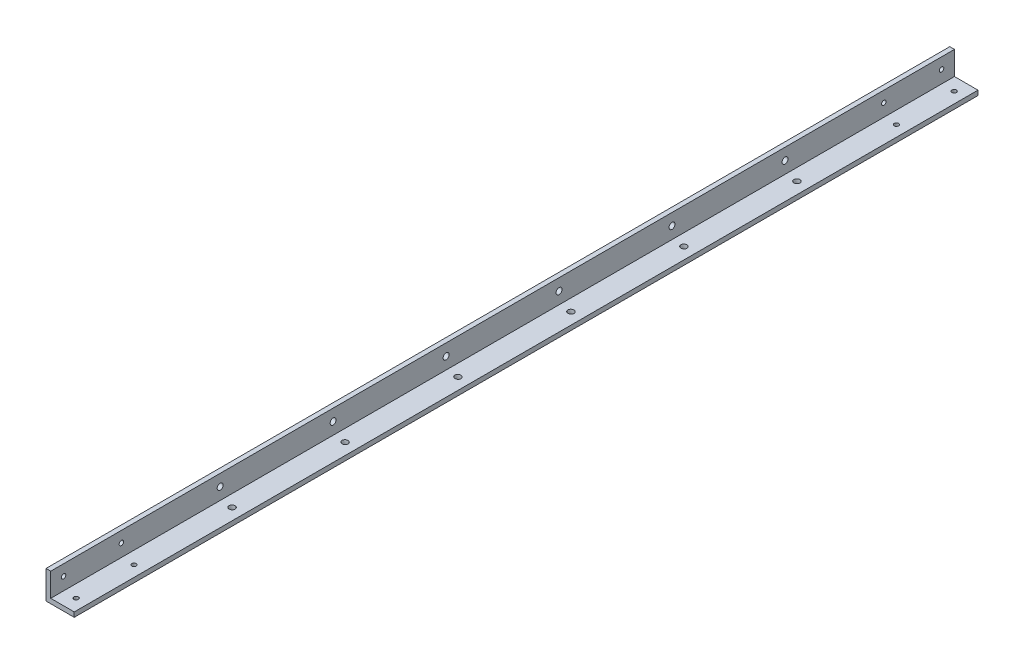
from build123d import *

# Parameters (mm, degrees)
BOSS_EXTRUDE1_DEPTH = 609.6
SKETCH3_R           = 1.5
CUT_EXTRUDE1_DEPTH  = 10
SKETCH4_R           = 1.5
CUT_EXTRUDE4_DEPTH  = 611.195022104
SKETCH5_R           = 2


with BuildPart() as part:
    # Sketch1 → Boss-Extrude1 (new body)
    with BuildSketch(Plane.XY):
        Polygon((0, 0), (19.05, 0), (19.05, 3.175), (3.175, 3.175), (3.175, 19.05), (0, 19.05), align=None)
    extrude(amount=BOSS_EXTRUDE1_DEPTH)

    # Sketch3 → Cut-Extrude1 (cut)
    with BuildSketch(Plane.XZ):
        with Locations((11.671, 600.906)):
            Circle(SKETCH3_R)
        with Locations((11.671, 561.94)):
            Circle(SKETCH3_R)
        with Locations((11.671, 47.66)):
            Circle(SKETCH3_R)
        with Locations((11.671, 8.694)):
            Circle(SKETCH3_R)
    extrude(amount=-CUT_EXTRUDE1_DEPTH, mode=Mode.SUBTRACT)

    # Sketch4 → Cut-Extrude4 (cut, through all)
    with BuildSketch(Plane(origin=(0, 0, 0), x_dir=(0, 0, -1), z_dir=(1, 0, 0))):
        with Locations((-8.694, 11.671)):
            Circle(SKETCH4_R)
        with Locations((-47.66, 11.671)):
            Circle(SKETCH4_R)
        with Locations((-600.906, 11.671)):
            Circle(SKETCH4_R)
        with Locations((-561.94, 11.671)):
            Circle(SKETCH4_R)
    extrude(amount=CUT_EXTRUDE4_DEPTH, mode=Mode.SUBTRACT)

    # Sketch5 → Cut-Revolve2 (revolve, cut)
    with BuildSketch(Plane(origin=(0, 0, 0), x_dir=(0, 0, -1), z_dir=(1, 0, 0))):
        with Locations((-342.9, 11.633938679)):
            Circle(SKETCH5_R)
        with Locations((-419.1, 11.671)):
            Circle(SKETCH5_R)
        with Locations((-495.3, 11.671)):
            Circle(SKETCH5_R)
        with Locations((-266.7, 11.633938679)):
            Circle(SKETCH5_R)
        with Locations((-190.5, 11.671)):
            Circle(SKETCH5_R)
        with Locations((-114.3, 11.671)):
            Circle(SKETCH5_R)
    revolve(axis=Axis((0, 0, 609.6), (0, 0, -1)), mode=Mode.SUBTRACT)


solid = part.part
